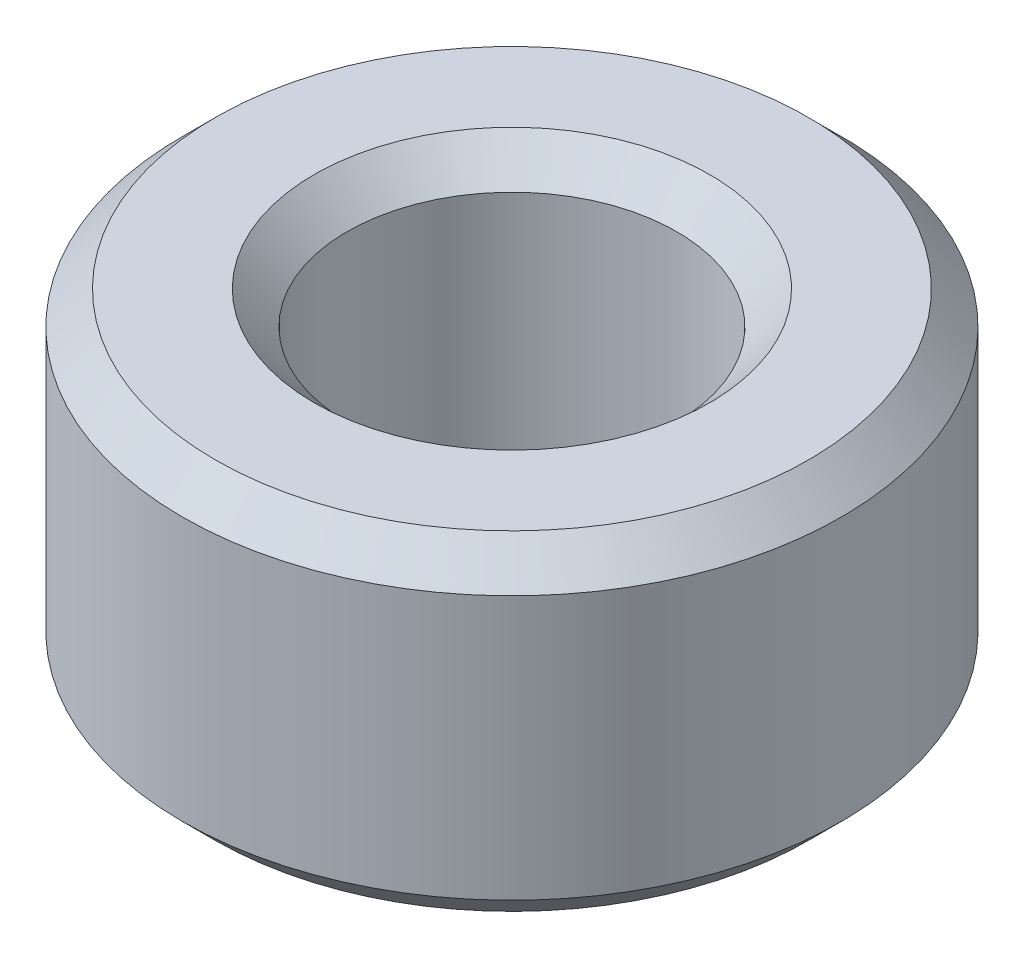
from build123d import *

# Parameters (mm, degrees)
SKETCH1_R           = 10
BOSS_EXTRUDE1_DEPTH = 10
SKETCH2_R           = 5
CUT_EXTRUDE1_DEPTH  = 18.320508076
CHAMFER1_SIZE       = 1


with BuildPart() as part:
    # Sketch1 → Boss-Extrude1 (new body)
    with BuildSketch(Plane(origin=(0, 0, 0), x_dir=(1, 0, 0), z_dir=(0, 1, 0))):
        Circle(SKETCH1_R)
    extrude(amount=BOSS_EXTRUDE1_DEPTH)

    # Sketch2 → Cut-Extrude1 (cut, through all)
    with BuildSketch(Plane(origin=(0, 0, 0), x_dir=(1, 0, 0), z_dir=(0, 1, 0))):
        Circle(SKETCH2_R)
    extrude(amount=CUT_EXTRUDE1_DEPTH, mode=Mode.SUBTRACT)

    # Chamfer1
    chamfer1_edges = [part.edges().sort_by_distance(p)[0] for p in [
        (-5, 10, 0),
        (-5, 0, 0),
        (-10, 0, 0),
        (-10, 10, 0),
    ]]
    chamfer(chamfer1_edges, length=CHAMFER1_SIZE)


solid = part.part
